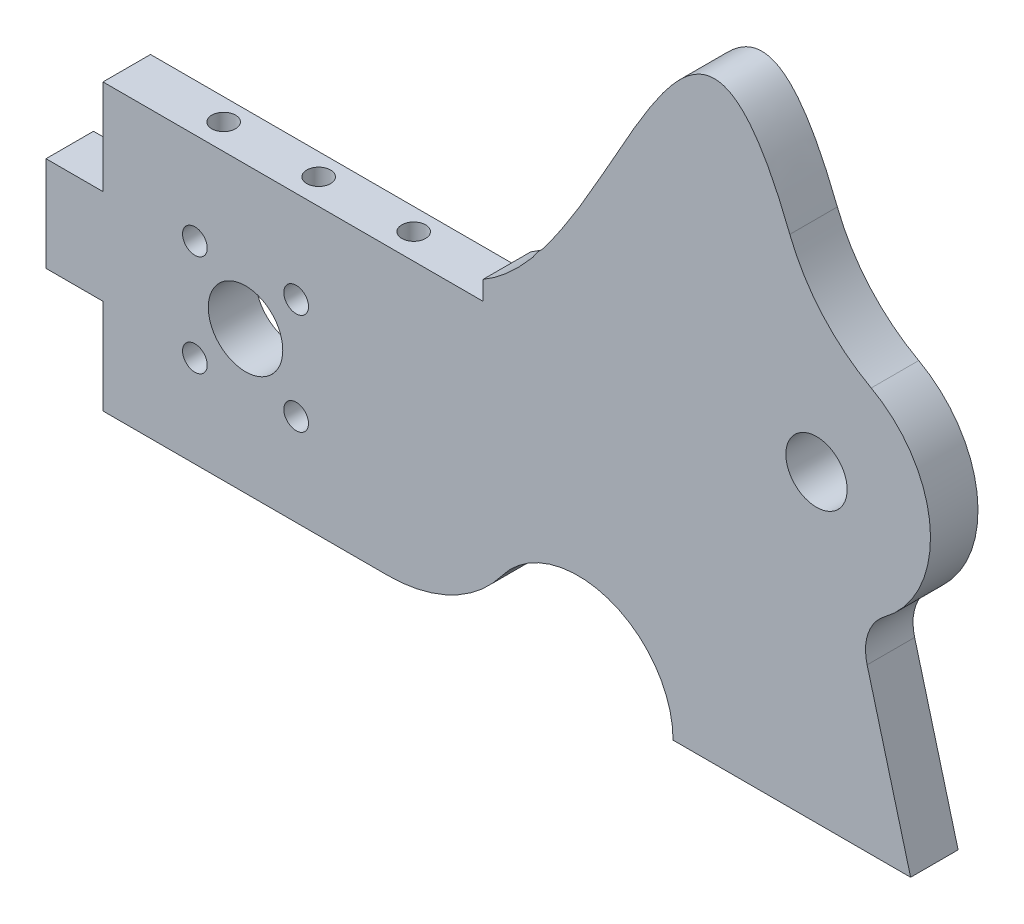
from build123d import *

# Parameters (mm, degrees)
SKETCH1_R           = 4.09575
SKETCH1_R_2         = 1.651
BOSS_EXTRUDE1_DEPTH = 6.35
SKETCH3_R           = 1.5875
CUT_EXTRUDE1_DEPTH  = 6.35
CUT_EXTRUDE2_DEPTH  = 6.35
SKETCH7_R           = 4.9784
CUT_EXTRUDE3_DEPTH  = 125.084268237
FILLET1_R           = 6.35
SKETCH8_W           = 50.8
SKETCH8_H           = 12.7
CUT_EXTRUDE4_DEPTH  = 50.8
CUT_EXTRUDE5_DEPTH  = 19.304
FILLET6_R           = 6.35
FILLET7_R           = 6.35
FILLET8_R           = 19.05
SKETCH10_R          = 1.5875
CUT_EXTRUDE6_DEPTH  = 6.35
SKETCH11_R          = 1.5875
CUT_EXTRUDE7_DEPTH  = 6.35
BOSS_EXTRUDE2_DEPTH = 6.35
FILLET9_R           = 24.13


with BuildPart() as part:
    # Sketch1 → Boss-Extrude1 (new body)
    with BuildSketch(Plane.XY):
        with BuildLine():
            Line((0, 0), (107.95, 0))
            Line((107.95, 0), (100.9362606, 26.175631792))
            Line((100.9362606, 26.175631792), (100.868755024, 26.427566033))
            ThreePointArc((100.868755024, 26.427566033), (110.348359368, 43.438223217), (95.367453293, 55.88))
            Line((95.367453293, 55.88), (0, 38.1))
            Line((0, 38.1), (0, 25.4))
            Line((0, 25.4), (-7.62, 25.4))
            Line((-7.62, 25.4), (-7.62, 12.7))
            Line((-7.62, 12.7), (0, 12.7))
            Line((0, 12.7), (0, 0))
        make_face()
        with Locations((95.367453293, 40.64)):
            Circle(SKETCH1_R, mode=Mode.SUBTRACT)
        with Locations((25.817011896, 25.817011896)):
            Circle(SKETCH1_R_2, mode=Mode.SUBTRACT)
        with Locations((25.817011896, 12.282988104)):
            Circle(SKETCH1_R_2, mode=Mode.SUBTRACT)
        with Locations((12.282988104, 12.282988104)):
            Circle(SKETCH1_R_2, mode=Mode.SUBTRACT)
        with Locations((12.282988104, 25.817011896)):
            Circle(SKETCH1_R_2, mode=Mode.SUBTRACT)
    extrude(amount=BOSS_EXTRUDE1_DEPTH)

    # Sketch3 → Cut-Extrude1 (cut)
    with BuildSketch(Plane.ZY):
        with Locations(Location((3.175, 31.75, 0), (0, 0, 270))):
            Circle(SKETCH3_R)
        with Locations(Location((3.175, 6.35, 0), (0, 0, 270))):
            Circle(SKETCH3_R)
    extrude(amount=-CUT_EXTRUDE1_DEPTH, mode=Mode.SUBTRACT)

    # Sketch6 → Cut-Extrude2 (cut)
    with BuildSketch(Plane.XY.offset(6.35)):
        with BuildLine():
            Line((50.8, 0), (76.2, 0))
            ThreePointArc((76.2, 0), (63.5, 12.7), (50.8, 0))
        make_face()
    extrude(amount=-CUT_EXTRUDE2_DEPTH, mode=Mode.SUBTRACT)

    # Sketch7 → Cut-Extrude3 (cut, through all)
    with BuildSketch(Plane.XY.offset(6.35)):
        with Locations((19.05, 19.05)):
            Circle(SKETCH7_R)
    extrude(amount=-CUT_EXTRUDE3_DEPTH, mode=Mode.SUBTRACT)

    # Fillet1
    fillet1_edges = [part.edges().sort_by_distance(p)[0] for p in [
        (100.868755024, 26.427566033, 3.175),
    ]]
    fillet(fillet1_edges, radius=FILLET1_R)

    # Sketch8 → Cut-Extrude4 (cut)
    with BuildSketch(Plane.XY.offset(6.35)):
        with Locations((25.4, 44.45)):
            Rectangle(SKETCH8_W, SKETCH8_H)
    extrude(amount=-CUT_EXTRUDE4_DEPTH, mode=Mode.SUBTRACT)

    # Sketch9 → Cut-Extrude5 (cut)
    with BuildSketch(Plane.XY.offset(6.35)):
        Polygon((50.8, 47.57098794), (50.8, 40.64), (57.15, 40.64), (57.15, 48.754861432), align=None)
    extrude(amount=-CUT_EXTRUDE5_DEPTH, mode=Mode.SUBTRACT)

    # Fillet6
    fillet6_edges = [part.edges().sort_by_distance(p)[0] for p in [
        (57.15, 40.64, 3.175),
    ]]
    fillet(fillet6_edges, radius=FILLET6_R - 0.0001)  # a hair under: the kernel refuses the full size

    # Fillet7
    fillet7_edges = [part.edges().sort_by_distance(p)[0] for p in [
        (57.15, 48.754861432, 3.175),
    ]]
    fillet(fillet7_edges, radius=FILLET7_R)

    # Fillet8
    fillet8_edges = [part.edges().sort_by_distance(p)[0] for p in [
        (50.8, 0, 3.175),
    ]]
    fillet(fillet8_edges, radius=FILLET8_R)

    # Sketch10 → Cut-Extrude6 (cut)
    with BuildSketch(Plane.XZ):
        with Locations(Location((97.79, 3.175, 0), (0, 0, 270))):
            Circle(SKETCH10_R)
        with Locations(Location((86.36, 3.175, 0), (0, 0, 270))):
            Circle(SKETCH10_R)
        with Locations(Location((31.75, 3.175, 0), (0, 0, 270))):
            Circle(SKETCH10_R)
        with Locations(Location((12.7, 3.175, 0), (0, 0, 270))):
            Circle(SKETCH10_R)
    extrude(amount=-CUT_EXTRUDE6_DEPTH, mode=Mode.SUBTRACT)

    # Sketch11 → Cut-Extrude7 (cut)
    with BuildSketch(Plane(origin=(0, 38.1, 0), x_dir=(1, 0, 0), z_dir=(0, 1, 0))):
        with Locations(Location((12.7, -2.922371253, 0), (0, 0, 270))):
            Circle(SKETCH11_R)
        with Locations(Location((25.4, -2.922371253, 0), (0, 0, 270))):
            Circle(SKETCH11_R)
        with Locations(Location((38.1, -2.922371253, 0), (0, 0, 270))):
            Circle(SKETCH11_R)
    extrude(amount=-CUT_EXTRUDE7_DEPTH, mode=Mode.SUBTRACT)

    # Sketch12 → Boss-Extrude2 (add)
    with BuildSketch(Plane.XY.offset(6.35)):
        with BuildLine():
            Line((50.8, 40.64), (85.027112904, 40.64))
            Line((85.027112904, 40.64), (95.367453293, 55.88))
            add(Edge.make_bspline(
                [(50.8, 40.64), (70.777788932, 52.178803671), (78.594281742, 111.543427795), (95.367453293, 55.88)],
                knots=[0, 0, 0, 0, 1, 1, 1, 1], degree=3))
        make_face()
    extrude(amount=-BOSS_EXTRUDE2_DEPTH)

    # Fillet9
    fillet9_edges = [part.edges().sort_by_distance(p)[0] for p in [
        (95.367453293, 55.88, 3.175),
    ]]
    fillet(fillet9_edges, radius=FILLET9_R)


solid = part.part
